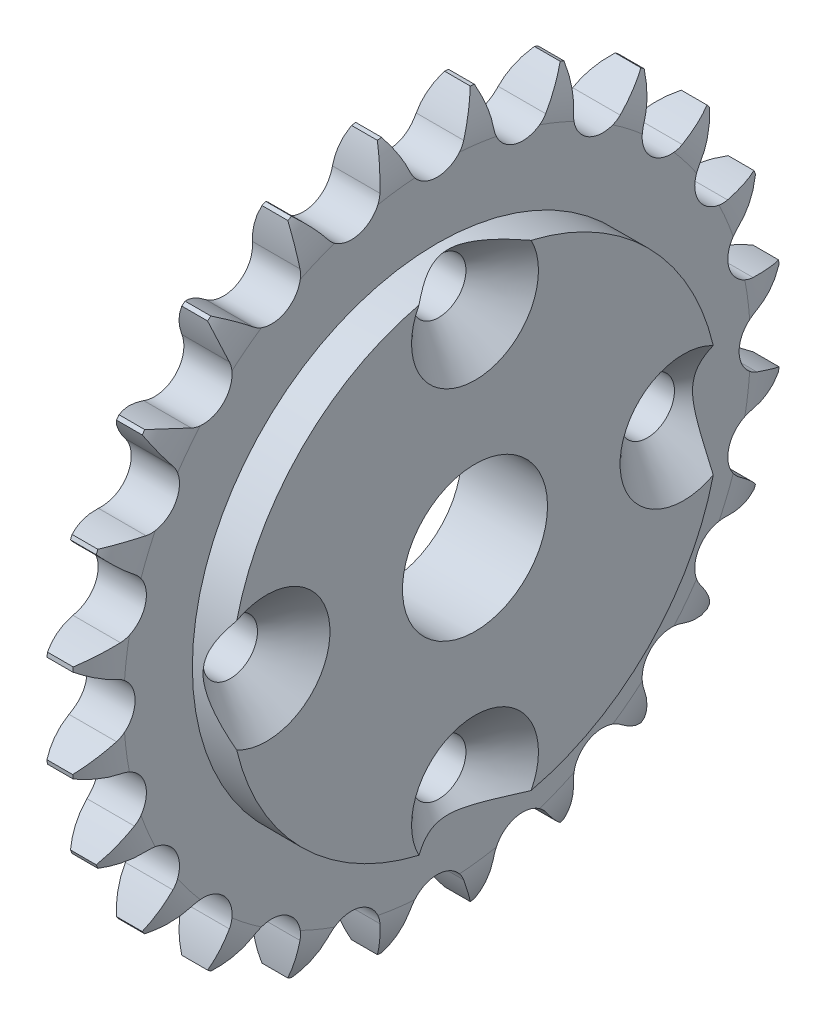
from build123d import *

# Parameters (mm, degrees)
TOOTHCUT_DEPTH      = 56.783395311
TEETHCUTS_COUNT     = 24
TEETHCUTS_ANGLE     = 345
BORSKE_R            = 5
BORE_DEPTH          = 50.0005
SKETCH1_R           = 27
SKETCH1_R_2         = 6
BOSS_EXTRUDE1_DEPTH = 22.6804
SKETCH2_R           = 39.495864355
TRIM_BOSS_DEPTH     = 18.5
SKETCH3_R           = 8
BORE_CENTRE_DEPTH   = 20
SKETCH4_R           = 3
CUT_EXTRUDE3_DEPTH  = 20
CHAMFER1_SIZE       = 4


with BuildPart() as part:
    # BasProSke → Base-Revolve (revolve)
    with BuildSketch(Plane(origin=(0, 0, 0), x_dir=(1, 0, 0), z_dir=(0, 1, 0)), mode=Mode.PRIVATE) as base_revolve_sk:
        with BuildLine():
            Line((0, 0), (0, 34.569178256))
            ThreePointArc((0, 34.569178256), (0.314698702, 36.997341142), (1.238, 39.265054745))
            Line((1.238, 39.265054745), (4.0816, 39.265054745))
            ThreePointArc((4.0816, 39.265054745), (5.004901298, 36.997341142), (5.3196, 34.569178256))
            Line((5.3196, 34.569178256), (5.3196, 0))
            Line((5.3196, 0), (0, 0))
        make_face()
    revolve(base_revolve_sk.sketch.rotate(Axis((-10, 0, 0), (1, 0, 0)), 180), axis=Axis((-10, 0, 0), (1, 0, 0)))

    # TooCutSke → ToothCut (cut, through all)
    with BuildSketch(Plane(origin=(0, 0, 0), x_dir=(0, 0, -1), z_dir=(1, 0, 0))):
        with BuildLine():
            ThreePointArc((2.975860512, 35.323899524), (3.973791538, 37.438985795), (5.214007684, 39.421741498))
            ThreePointArc((5.214007684, 39.421741498), (0, 39.765054745), (-5.214007684, 39.421741498))
            ThreePointArc((-5.214007684, 39.421741498), (-3.973791538, 37.438985795), (-2.975860512, 35.323899524))
            ThreePointArc((-2.975860512, 35.323899524), (0, 33.311929745), (2.975860512, 35.323899524))
        make_face()
    toothcut = extrude(amount=TOOTHCUT_DEPTH, mode=Mode.SUBTRACT)

    # TeethCuts: ToothCut ×24 about axis
    teethcuts_axis = Axis((-10, 0, 0), (1, 0, 0))
    for i in range(1, TEETHCUTS_COUNT):
        add(toothcut.rotate(teethcuts_axis, i * TEETHCUTS_ANGLE / (TEETHCUTS_COUNT - 1)), mode=Mode.SUBTRACT)

    # BorSke → Bore (cut, symmetric)
    with BuildSketch(Plane(origin=(0, 0, 0), x_dir=(0, 0, -1), z_dir=(1, 0, 0))):
        with Locations(Location((0, 0, 0), (0, 0, 180))):
            Circle(BORSKE_R)
    extrude(amount=BORE_DEPTH, both=True, mode=Mode.SUBTRACT)

    # Sketch1 → Boss-Extrude1 (add)
    with BuildSketch(Plane(origin=(5.3196, 0, 0), x_dir=(0, 0, -1), z_dir=(1, 0, 0))):
        with Locations(Location((0, 0, 0), (0, 0, 180))):
            Circle(SKETCH1_R)
        Circle(SKETCH1_R_2, mode=Mode.SUBTRACT)
    extrude(amount=BOSS_EXTRUDE1_DEPTH)

    # Sketch2 → trim boss (cut)
    with BuildSketch(Plane(origin=(28, 0, 0), x_dir=(0, 0, -1), z_dir=(1, 0, 0))):
        Circle(SKETCH2_R)
    extrude(amount=-TRIM_BOSS_DEPTH, mode=Mode.SUBTRACT)

    # Sketch3 → bore centre (cut)
    with BuildSketch(Plane(origin=(9.5, 0, 0), x_dir=(0, 0, -1), z_dir=(1, 0, 0))):
        Circle(SKETCH3_R)
    extrude(amount=-BORE_CENTRE_DEPTH, mode=Mode.SUBTRACT)

    # Sketch4 → Cut-Extrude3 (cut)
    with BuildSketch(Plane.ZY):
        with Locations((0, 23)):
            Circle(SKETCH4_R)
        with Locations((23, 0)):
            Circle(SKETCH4_R)
        with Locations((0, -23)):
            Circle(SKETCH4_R)
        with Locations((-23, 0)):
            Circle(SKETCH4_R)
    extrude(amount=-CUT_EXTRUDE3_DEPTH, mode=Mode.SUBTRACT)

    # Chamfer1
    # the kernel refuses this chamfer: 4 mm, written as the material it takes off along each edge
    with BuildSketch(Plane(origin=(9.5, 23, 0), x_dir=(0, 0, 1), z_dir=(0, -1, 0))) as chamfer1_piece_1:
        Polygon((3, CHAMFER1_SIZE), (3 + CHAMFER1_SIZE, 0), (3, 0), align=None)
    revolve(axis=Axis((9.5, 23, 0), (-1, 0, 0)), mode=Mode.SUBTRACT)
    with BuildSketch(Plane(origin=(9.5, 0, 23), x_dir=(0, 0, 1), z_dir=(0, -1, 0))) as chamfer1_piece_2:
        Polygon((3, CHAMFER1_SIZE), (3 + CHAMFER1_SIZE, 0), (3, 0), align=None)
    revolve(axis=Axis((9.5, 0, 23), (-1, 0, 0)), mode=Mode.SUBTRACT)
    with BuildSketch(Plane(origin=(9.5, -23, 0), x_dir=(0, 0, 1), z_dir=(0, -1, 0))) as chamfer1_piece_3:
        Polygon((3, CHAMFER1_SIZE), (3 + CHAMFER1_SIZE, 0), (3, 0), align=None)
    revolve(axis=Axis((9.5, -23, 0), (-1, 0, 0)), mode=Mode.SUBTRACT)
    with BuildSketch(Plane(origin=(9.5, 0, -23), x_dir=(0, 0, 1), z_dir=(0, -1, 0))) as chamfer1_piece_4:
        Polygon((3, CHAMFER1_SIZE), (3 + CHAMFER1_SIZE, 0), (3, 0), align=None)
    revolve(axis=Axis((9.5, 0, -23), (-1, 0, 0)), mode=Mode.SUBTRACT)


solid = part.part
